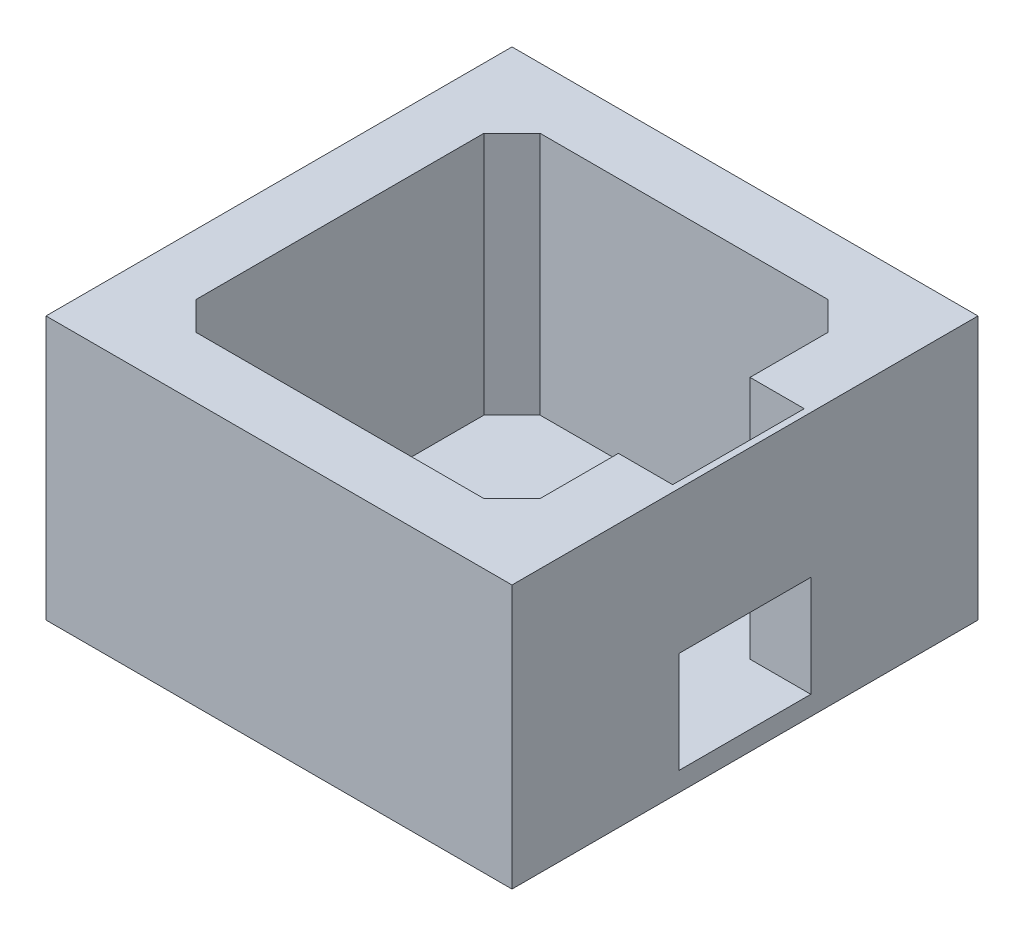
from build123d import *

# Parameters (mm, degrees)
SKETCH1_W           = 58.42
SKETCH1_H           = 58.42
BOSS_EXTRUDE1_DEPTH = 33.02
CUT_EXTRUDE1_DEPTH  = 30.600000014
SKETCH3_W           = 16.5
SKETCH3_H           = 12.7
CUT_EXTRUDE2_DEPTH  = 30.600000014


with BuildPart() as part:
    # Sketch1 → Boss-Extrude1 (new body)
    with BuildSketch(Plane(origin=(0, 0, 0), x_dir=(1, 0, 0), z_dir=(0, 1, 0))):
        with Locations((29.21, 29.21)):
            Rectangle(SKETCH1_W, SKETCH1_H)
    extrude(amount=BOSS_EXTRUDE1_DEPTH)

    # Sketch2 → Cut-Extrude1 (cut)
    with BuildSketch(Plane(origin=(0, 33.02, 0), x_dir=(1, 0, 0), z_dir=(0, 1, 0))):
        Polygon((11.155533906, 50.8), (47.264466094, 50.8), (50.8, 47.264466094), (50.8, 37.46), (57.6, 37.46), (57.6, 20.96), (50.8, 20.96), (50.8, 11.155533906), (47.264466094, 7.62), (11.155533906, 7.62), (7.62, 11.155533906), (7.62, 47.264466094), align=None)
    extrude(amount=-CUT_EXTRUDE1_DEPTH, mode=Mode.SUBTRACT)

    # Sketch3 → Cut-Extrude2 (cut)
    with BuildSketch(Plane(origin=(58.42, 0, 0), x_dir=(0, 0, -1), z_dir=(1, 0, 0))):
        with Locations((29.21, 8.769999986)):
            Rectangle(SKETCH3_W, SKETCH3_H)
    extrude(amount=-CUT_EXTRUDE2_DEPTH, mode=Mode.SUBTRACT)


solid = part.part
